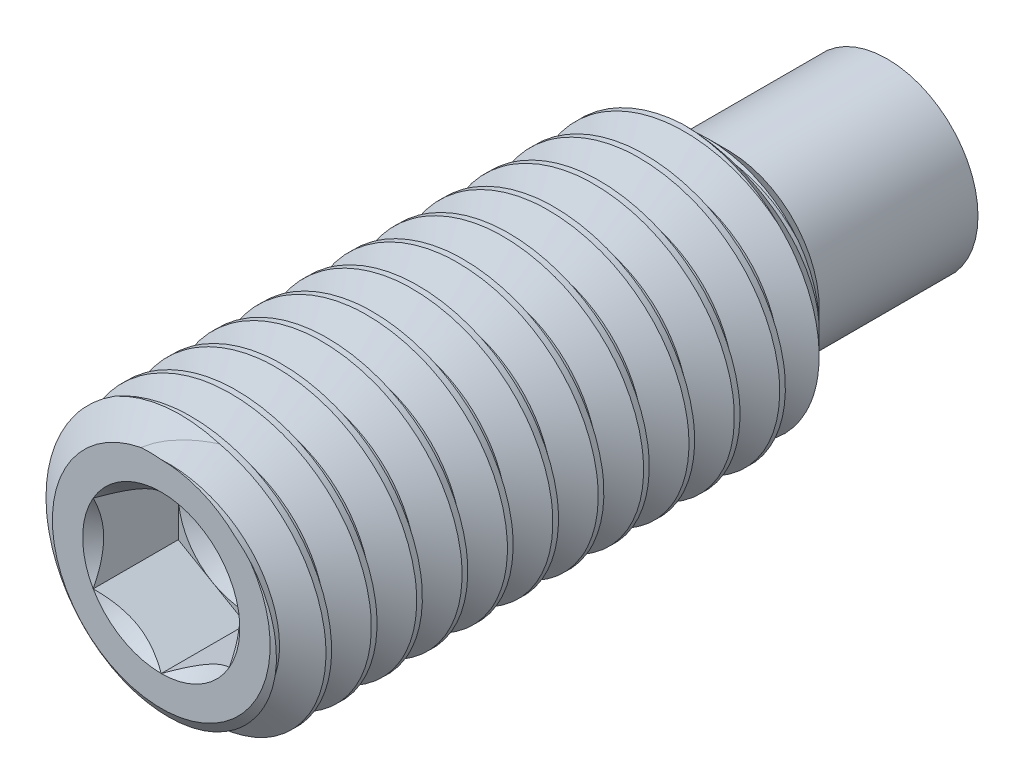
from build123d import *

# Parameters (mm, degrees)
CUT_SWEEP2_PITCH    = 0.5
CUT_EXTRUDE10_DEPTH = 0.9375


with BuildPart() as part:
    # Sketch22 → Revolve1 (revolve)
    with BuildSketch(Plane(origin=(0, 0, 0), x_dir=(0, 0, -1), z_dir=(1, 0, 0)), mode=Mode.PRIVATE) as revolve1_sk:
        Polygon((-4, 0), (-4, 1.2), (-3.789937739, 1.5), (1.75, 1.5), (2.25, 1), (4, 1), (4, 0), align=None)
    revolve(revolve1_sk.sketch.rotate(Axis((0, 0, -4), (0, 0, 1)), 90), axis=Axis((0, 0, -4), (0, 0, 1)))

    # Cut-Sweep2: the profile of Sketch28 profile screwed along a right-hand helix of 17 turns, 6 arcs to a turn; built about Z, then put on its axis
    cut_sweep2_z = Axis((0, 0, 0), (0, 0, 1))
    cut_sweep2_corners = [(1.5003, 0, 0.000173205), (1.5003, 0, -0.437673205), (1.175240474, 0, -0.25), (1.175240474, 0, -0.1875)]
    with BuildLine(mode=Mode.PRIVATE) as cut_sweep2_profile:
        Line(cut_sweep2_corners[0], cut_sweep2_corners[1])
        Line(cut_sweep2_corners[1], cut_sweep2_corners[2])
        Line(cut_sweep2_corners[2], cut_sweep2_corners[3])
        Line(cut_sweep2_corners[3], cut_sweep2_corners[0])
    cut_sweep2_cap = Face(cut_sweep2_profile.wire())
    cut_sweep2_turn_angles = [0, 30, 60, 90, 120, 150, 180, 210, 240, 270, 300, 330, 360]
    cut_sweep2_turn_weights = [1, 0.8660254037844387, 1, 0.8660254037844387, 1, 0.8660254037844387, 1, 0.8660254037844387, 1, 0.8660254037844387, 1, 0.8660254037844387, 1]
    cut_sweep2_turn_rails = [Edge.make_bspline([Vector(p[0], p[1], 0).rotate(cut_sweep2_z, cut_sweep2_turn_angles[k]) / cut_sweep2_turn_weights[k] + Vector(0, 0, p[2] + CUT_SWEEP2_PITCH * cut_sweep2_turn_angles[k] / 360) for k in range(13)], [0, 0, 0, 1, 1, 2, 2, 3, 3, 4, 4, 5, 5, 6, 6, 6], 2, cut_sweep2_turn_weights) for p in cut_sweep2_corners]
    cut_sweep2_turn_sides = [Face.make_surface_from_curves(cut_sweep2_turn_rails[p[0]], cut_sweep2_turn_rails[p[1]]) for p in [(0, 1), (1, 2), (2, 3), (3, 0)]]
    cut_sweep2 = Plane(origin=(0, 0, -2.25), x_dir=(0, 1, 0), z_dir=(0, 0, 1)) * Solid(Shell([*[p.moved(Location((0, 0, CUT_SWEEP2_PITCH * i))) for i in range(17) for p in cut_sweep2_turn_sides], cut_sweep2_cap, cut_sweep2_cap.rotate(cut_sweep2_z, 6120).moved(Location((0, 0, CUT_SWEEP2_PITCH * 6120 / 360)))]))
    add(cut_sweep2, mode=Mode.SUBTRACT)

    # Sketch23 → Cut-Extrude10 (cut)
    with BuildSketch(Plane.XY.offset(4)):
        Polygon((0, 0.866025404), (-0.75, 0.433012702), (-0.75, -0.433012702), (0, -0.866025404), (0.75, -0.433012702), (0.75, 0.433012702), align=None)
    extrude(amount=-CUT_EXTRUDE10_DEPTH, mode=Mode.SUBTRACT)

    # Cut-Extrude11 cone 1 section (through the dimple's axis) → Cut-Extrude11 (revolve, cut)
    with BuildSketch(Plane(origin=(0, 0, 4), x_dir=(0, -1, 0), z_dir=(1, 0, 0))):
        Polygon((0, 0), (0.866025404, 0), (0, 0.866025404), align=None)
    revolve(axis=Axis((0, 0, 4), (0, 0, -1)), mode=Mode.SUBTRACT)

    # Cut-Extrude12 cone 1 section (through the dimple's axis) → Cut-Extrude12 (revolve, cut)
    with BuildSketch(Plane(origin=(0, 0, 3.0625), x_dir=(0, -1, 0), z_dir=(1, 0, 0))):
        Polygon((0, 0), (0.75, 0), (0, 0.433012702), align=None)
    revolve(axis=Axis((0, 0, 3.0625), (0, 0, -1)), mode=Mode.SUBTRACT)


solid = part.part
